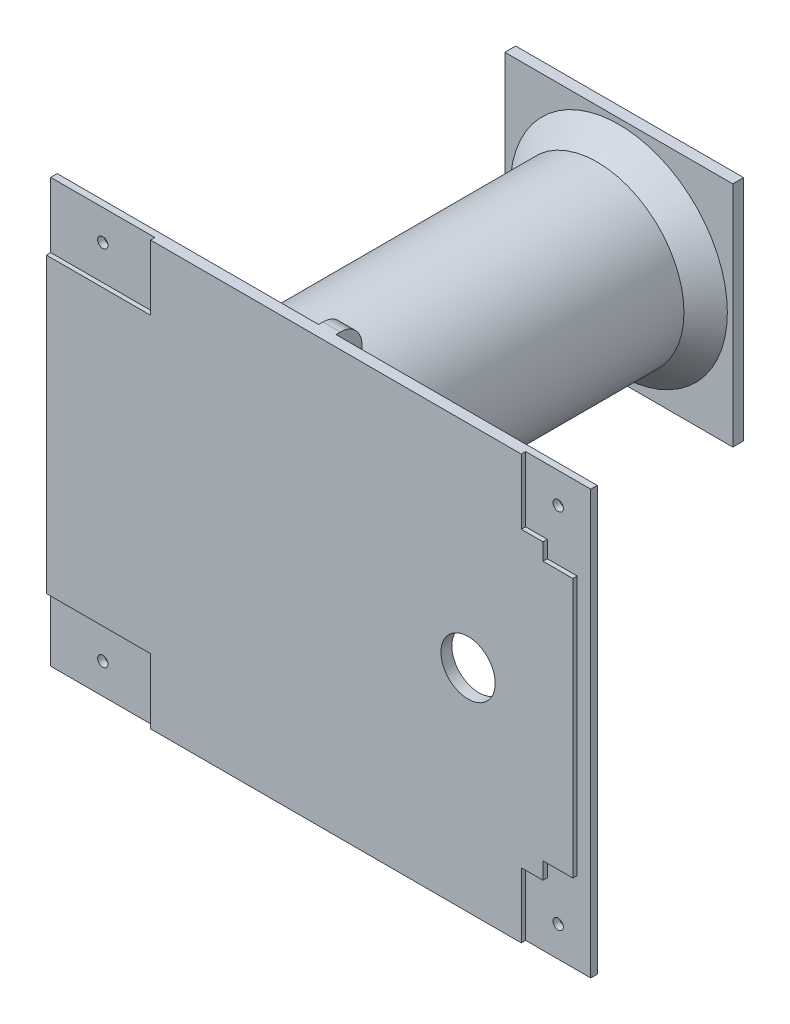
from build123d import *

# Parameters (mm, degrees)
CROQUIS1_W                 = 248.76
CROQUIS1_H                 = 195
SALIENTE_EXTRUIR1_DEPTH    = 5
CROQUIS2_W                 = 48
CROQUIS2_H                 = 30
CROQUIS2_W_2               = 30
CORTAR_EXTRUIR1_DEPTH      = 2
CROQUIS3_R                 = 2.375
CORTAR_EXTRUIR2_DEPTH      = 10
CROQUIS4_R                 = 40
SALIENTE_EXTRUIR2_DEPTH    = 196.5
CROQUIS5_R                 = 12.5
CORTAR_EXTRUIR3_DEPTH      = 10
CROQUIS12_W                = 12
CROQUIS12_H                = 30
SALIENTE_EXTRUIR3_DEPTH    = 4
REDONDEO1_R                = 10
REDONDEO2_R                = 10
REDONDEO3_R                = 10
CORTAR_EXTRUIR5_DEPTH      = 255.266033949
CORTAR_EXTRUIR5_DEPTH_BACK = 255.266033949
CROQUIS13_R                = 1.625
CORTAR_EXTRUIR7_DEPTH      = 2
CROQUIS16_W                = 105
CROQUIS16_H                = 105
SALIENTE_EXTRUIR4_DEPTH    = 5
CHAFL_N1_SIZE              = 10


with BuildPart() as part:
    # Croquis1 → Saliente-Extruir1 (new body)
    with BuildSketch(Plane.XY):
        with Locations((7.088293187, 0.26268)):
            Rectangle(CROQUIS1_W, CROQUIS1_H)
    extrude(amount=SALIENTE_EXTRUIR1_DEPTH)

    # Croquis2 → Cortar-Extruir1 (cut)
    with BuildSketch(Plane.XY.offset(5)):
        with Locations((-93.291706813, -82.23732)):
            Rectangle(CROQUIS2_W, CROQUIS2_H)
        with Locations((116.468293187, 82.76268)):
            Rectangle(CROQUIS2_W_2, CROQUIS2_H)
        with Locations((116.468293187, -82.23732)):
            Rectangle(CROQUIS2_W_2, CROQUIS2_H)
        with Locations((-93.291706813, 82.76268)):
            Rectangle(CROQUIS2_W, CROQUIS2_H)
    extrude(amount=-CORTAR_EXTRUIR1_DEPTH, mode=Mode.SUBTRACT)

    # Croquis3 → Cortar-Extruir2 (cut)
    with BuildSketch(Plane.XY.offset(5)):
        with Locations((-93.291706813, 83.76268)):
            Circle(CROQUIS3_R)
        with Locations((-93.291706813, -83.23732)):
            Circle(CROQUIS3_R)
        with Locations((116.468293187, 83.76268)):
            Circle(CROQUIS3_R)
        with Locations((116.468293187, -83.23732)):
            Circle(CROQUIS3_R)
    extrude(amount=-CORTAR_EXTRUIR2_DEPTH, mode=Mode.SUBTRACT)

    # Croquis4 → Saliente-Extruir2 (add)
    with BuildSketch(Plane(origin=(0, 0, 0), x_dir=(-1, 0, 0), z_dir=(0, 0, -1))):
        with Locations((55.101706813, 0.26268)):
            Circle(CROQUIS4_R)
    extrude(amount=SALIENTE_EXTRUIR2_DEPTH)

    # Croquis5 → Cortar-Extruir3 (cut)
    with BuildSketch(Plane(origin=(0, 0, 0), x_dir=(-1, 0, 0), z_dir=(0, 0, -1))):
        with Locations((-76.968293187, 0.26268)):
            Circle(CROQUIS5_R)
    extrude(amount=-CORTAR_EXTRUIR3_DEPTH, mode=Mode.SUBTRACT)

    # Croquis12 → Saliente-Extruir3 (add, symmetric)
    with BuildSketch(Plane(origin=(7.088293187, 0, 0), x_dir=(0, 0, -1), z_dir=(1, 0, 0))):
        with Locations((6, 82.76268)):
            Rectangle(CROQUIS12_W, CROQUIS12_H)
        with Locations((6, -82.23732)):
            Rectangle(CROQUIS12_W, CROQUIS12_H)
    extrude(amount=SALIENTE_EXTRUIR3_DEPTH, both=True)

    # Redondeo1
    redondeo1_edges = [part.edges().sort_by_distance(p)[0] for p in [
        (7.088293187, -67.23732, 0),
        (7.088293187, 67.76268, 0),
    ]]
    fillet(redondeo1_edges, radius=REDONDEO1_R)

    # Redondeo2
    redondeo2_edges = [part.edges().sort_by_distance(p)[0] for p in [
        (7.088293187, 67.76268, -12),
        (7.088293187, -67.23732, -12),
    ]]
    fillet(redondeo2_edges, radius=REDONDEO2_R)

    # Redondeo3
    redondeo3_edges = [part.edges().sort_by_distance(p)[0] for p in [
        (7.088293187, -97.23732, -12),
        (7.088293187, 97.76268, -12),
    ]]
    fillet(redondeo3_edges, radius=REDONDEO3_R)

    # Croquis13 → Cortar-Extruir5 (cut, two sides: drawn at the far end of the back side and taken through both)
    with BuildSketch(Plane(origin=(11.088293187, 0, 0), x_dir=(0, 0, -1), z_dir=(1, 0, 0)).offset(-CORTAR_EXTRUIR5_DEPTH_BACK)):
        with Locations((6, 87.76268)):
            Circle(CROQUIS13_R)
        with Locations((6, 77.76268)):
            Circle(CROQUIS13_R)
        with Locations((6, -77.23732)):
            Circle(CROQUIS13_R)
        with Locations((6, -87.23732)):
            Circle(CROQUIS13_R)
    extrude(amount=CORTAR_EXTRUIR5_DEPTH + CORTAR_EXTRUIR5_DEPTH_BACK, mode=Mode.SUBTRACT)

    # Croquis15 → Cortar-Extruir7 (cut)
    with BuildSketch(Plane.XY.offset(5)):
        Polygon((111.468293187, 67.76268), (131.468293187, 67.76268), (131.468293187, -67.23732), (111.468293187, -67.23732), (111.468293187, -59.48732), (125.218293187, -59.48732), (125.218293187, 60.01268), (111.468293187, 60.01268), align=None)
    extrude(amount=-CORTAR_EXTRUIR7_DEPTH, mode=Mode.SUBTRACT)

    # Croquis16 → Saliente-Extruir4 (add)
    with BuildSketch(Plane(origin=(0, 0, -196.5), x_dir=(-1, 0, 0), z_dir=(0, 0, -1))):
        with Locations((55.101706813, 0.26268)):
            Rectangle(CROQUIS16_W, CROQUIS16_H)
    extrude(amount=SALIENTE_EXTRUIR4_DEPTH)

    # Chaflán1
    chafl_n1_edges = [part.edges().sort_by_distance(p)[0] for p in [
        (-15.101706813, 0.26268, -196.5),
    ]]
    chamfer(chafl_n1_edges, length=CHAFL_N1_SIZE)


solid = part.part
